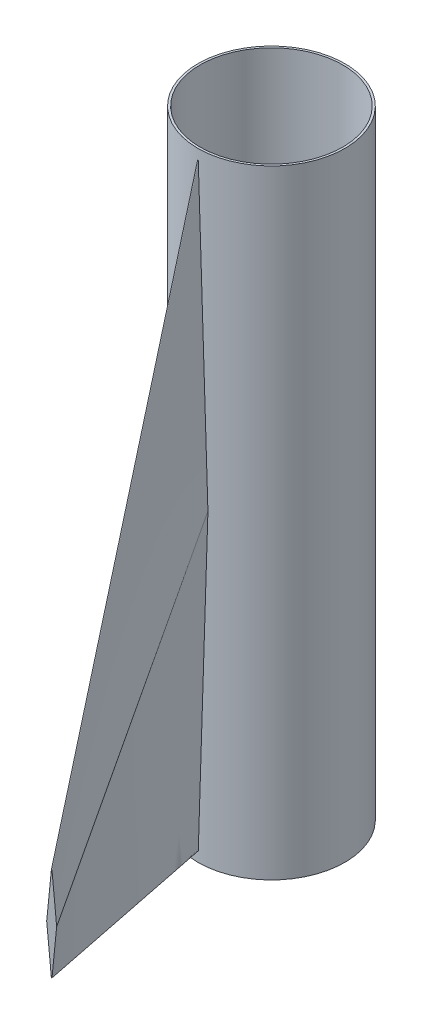
from build123d import *

# Parameters (mm, degrees)
SKETCH1_R           = 28.067
SKETCH1_R_2         = 27.2415
BOSS_EXTRUDE1_DEPTH = 236.22


with BuildPart() as part:
    # Sketch1 → Boss-Extrude1 (new body)
    with BuildSketch(Plane(origin=(0, 0, 0), x_dir=(1, 0, 0), z_dir=(0, 1, 0))):
        with Locations(Location((0, 0, 0), (0, 0, 270))):
            Circle(SKETCH1_R)
        with Locations(Location((0, 0, 0), (0, 0, 270))):
            Circle(SKETCH1_R_2, mode=Mode.SUBTRACT)
    extrude(amount=BOSS_EXTRUDE1_DEPTH)


with BuildPart() as body_2:
    # Loft1: read off the stored shape, not the designer's step
    # Loft1: loft between two sections, ruled curve by curve
    loft1_from = [
        Edge.make_bspline([(3.81, 118.11, 28.067), (3.503077831, 127.624587232, 28.067), (2.887899486, 146.695115948, 28.067), (1.964126834, 175.332068151, 28.067), (1.04238228, 203.906149329, 28.067), (0.431216774, 222.852280019, 28.067), (0.126472807, 232.299342976, 28.067), (0.123006002, 232.313332636, 28.067), (0.115080241, 232.337224944, 28.067), (0.10298293, 232.35623166, 28.067), (0.087343073, 232.37424612, 28.067), (0.070675742, 232.387000998, 28.067), (0.053484065, 232.396721358, 28.067), (0.035854911, 232.403222586, 28.067), (0.017991342, 232.407124879, 28.067), (-6.82e-07, 232.408360384, 28.067), (-0.017991629, 232.407121833, 28.067), (-0.035855076, 232.403224607, 28.067), (-0.053483943, 232.396720213, 28.067), (-0.070675818, 232.387001668, 28.067), (-0.087343032, 232.374245764, 28.067), (-0.102982953, 232.356231861, 28.067), (-0.11508023, 232.337224851, 28.067), (-0.123006006, 232.313332673, 28.067), (-0.126472807, 232.299342976, 28.067), (-0.431216774, 222.852280019, 28.067), (-1.04238228, 203.906149329, 28.067), (-1.964126834, 175.332068151, 28.067), (-2.887899486, 146.695115948, 28.067), (-3.503077831, 127.624587232, 28.067), (-3.81, 118.11, 28.067)], [0, 0, 0, 0, 0.124246772, 0.248493545, 0.372740317, 0.49698709, 0.49698709, 0.497175397, 0.497363703, 0.497740317, 0.498116931, 0.498493545, 0.498870159, 0.499246772, 0.499623386, 0.5, 0.500376614, 0.500753228, 0.501129841, 0.501506455, 0.501883069, 0.502259683, 0.502636297, 0.502824603, 0.50301291, 0.50301291, 0.627259683, 0.751506455, 0.875753228, 1, 1, 1, 1], 3),
        Edge.make_bspline([(-3.81, 118.11, 28.067), (-3.503077831, 108.595412768, 28.067), (-2.887899486, 89.524884052, 28.067), (-1.964126834, 60.887931849, 28.067), (-1.04238228, 32.313850671, 28.067), (-0.431216774, 13.367719981, 28.067), (-0.126472807, 3.920657024, 28.067), (-0.123006002, 3.906667364, 28.067), (-0.115080241, 3.882775056, 28.067), (-0.10298293, 3.86376834, 28.067), (-0.087343073, 3.84575388, 28.067), (-0.070675742, 3.832999002, 28.067), (-0.053484065, 3.823278642, 28.067), (-0.035854911, 3.816777414, 28.067), (-0.017991342, 3.812875121, 28.067), (6.82e-07, 3.811639616, 28.067), (0.017991629, 3.812878167, 28.067), (0.035855076, 3.816775393, 28.067), (0.053483943, 3.823279787, 28.067), (0.070675818, 3.832998332, 28.067), (0.087343032, 3.845754236, 28.067), (0.102982953, 3.863768139, 28.067), (0.11508023, 3.882775149, 28.067), (0.123006006, 3.906667327, 28.067), (0.126472807, 3.920657024, 28.067), (0.431216774, 13.367719981, 28.067), (1.04238228, 32.313850671, 28.067), (1.964126834, 60.887931849, 28.067), (2.887899486, 89.524884052, 28.067), (3.503077831, 108.595412768, 28.067), (3.81, 118.11, 28.067)], [0, 0, 0, 0, 0.124246772, 0.248493545, 0.372740317, 0.49698709, 0.49698709, 0.497175397, 0.497363703, 0.497740317, 0.498116931, 0.498493545, 0.498870159, 0.499246772, 0.499623386, 0.5, 0.500376614, 0.500753228, 0.501129841, 0.501506455, 0.501883069, 0.502259683, 0.502636297, 0.502824603, 0.50301291, 0.50301291, 0.627259683, 0.751506455, 0.875753228, 1, 1, 1, 1], 3),
    ]
    loft1_to = [
        Edge.make_bspline([(1.905, 7.62, 83.947), (1.75678081, 9.102191897, 83.947), (1.460978397, 12.060216035, 83.947), (1.017749634, 16.492503656, 83.947), (0.573579452, 20.934205479, 83.947), (0.275874643, 23.911253566, 83.947), (0.126143135, 25.408568647, 83.947), (0.125591007, 25.413293851, 83.947), (0.123876537, 25.423441801, 83.947), (0.120187299, 25.437291664, 83.947), (0.111999967, 25.455317895, 83.947), (0.098765983, 25.474293033, 83.947), (0.079198941, 25.493759592, 83.947), (0.055093099, 25.509840608, 83.947), (0.028242712, 25.518659119, 83.947), (2.6716e-05, 25.5212587, 83.947), (-0.028175953, 25.518682929, 83.947), (-0.055019681, 25.509900581, 83.947), (-0.079158853, 25.493880432, 83.947), (-0.098766267, 25.47445465, 83.947), (-0.112014717, 25.455455404, 83.947), (-0.120200134, 25.43737158, 83.947), (-0.123882064, 25.423471986, 83.947), (-0.125592023, 25.413298911, 83.947), (-0.126143135, 25.408568647, 83.947), (-0.275874643, 23.911253566, 83.947), (-0.573579452, 20.934205479, 83.947), (-1.017749634, 16.492503656, 83.947), (-1.460978397, 12.060216035, 83.947), (-1.75678081, 9.102191897, 83.947), (-1.905, 7.62, 83.947)], [0, 0, 0, 0, 0.124246772, 0.248493545, 0.372740317, 0.49698709, 0.49698709, 0.497175397, 0.497363703, 0.497740317, 0.498116931, 0.498493545, 0.498870159, 0.499246772, 0.499623386, 0.5, 0.500376614, 0.500753228, 0.501129841, 0.501506455, 0.501883069, 0.502259683, 0.502636297, 0.502824603, 0.50301291, 0.50301291, 0.627259683, 0.751506455, 0.875753228, 1, 1, 1, 1], 3),
        Edge.make_bspline([(-1.905, 7.62, 83.947), (-1.75678081, 6.137808103, 83.947), (-1.460978397, 3.179783965, 83.947), (-1.017749634, -1.252503656, 83.947), (-0.573579452, -5.694205479, 83.947), (-0.275874643, -8.671253566, 83.947), (-0.126143135, -10.168568647, 83.947), (-0.125591007, -10.173293851, 83.947), (-0.123876537, -10.183441801, 83.947), (-0.120187299, -10.197291664, 83.947), (-0.111999967, -10.215317895, 83.947), (-0.098765983, -10.234293033, 83.947), (-0.079198941, -10.253759592, 83.947), (-0.055093099, -10.269840608, 83.947), (-0.028242712, -10.278659119, 83.947), (-2.6716e-05, -10.2812587, 83.947), (0.028175953, -10.278682929, 83.947), (0.055019681, -10.269900581, 83.947), (0.079158853, -10.253880432, 83.947), (0.098766267, -10.23445465, 83.947), (0.112014717, -10.215455404, 83.947), (0.120200134, -10.19737158, 83.947), (0.123882064, -10.183471986, 83.947), (0.125592023, -10.173298911, 83.947), (0.126143135, -10.168568647, 83.947), (0.275874643, -8.671253566, 83.947), (0.573579452, -5.694205479, 83.947), (1.017749634, -1.252503656, 83.947), (1.460978397, 3.179783965, 83.947), (1.75678081, 6.137808103, 83.947), (1.905, 7.62, 83.947)], [0, 0, 0, 0, 0.124246772, 0.248493545, 0.372740317, 0.49698709, 0.49698709, 0.497175397, 0.497363703, 0.497740317, 0.498116931, 0.498493545, 0.498870159, 0.499246772, 0.499623386, 0.5, 0.500376614, 0.500753228, 0.501129841, 0.501506455, 0.501883069, 0.502259683, 0.502636297, 0.502824603, 0.50301291, 0.50301291, 0.627259683, 0.751506455, 0.875753228, 1, 1, 1, 1], 3),
    ]
    loft1 = Solid(Shell([*[Face.make_surface_from_curves(loft1_from[k], loft1_to[k]) for k in range(2)], Face(Wire(loft1_from)), Face(Wire(loft1_to))]))
    add(loft1)


solid = Compound([part.part, body_2.part])
